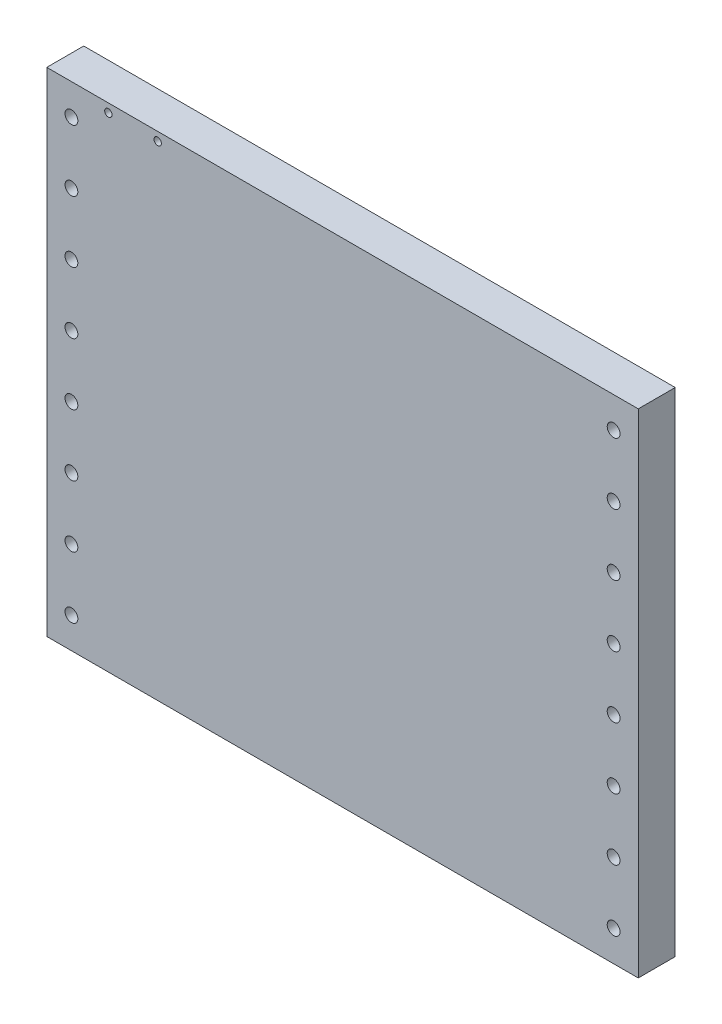
from build123d import *

# Parameters (mm, degrees)
SKETCH1_W           = 240
SKETCH1_H           = 200
BOSS_EXTRUDE1_DEPTH = 7.5
SKETCH4_R           = 2.6
CUT_EXTRUDE3_DEPTH  = 157.923548265
LPATTERN1_COUNT     = 8
LPATTERN1_PITCH     = 25
SKETCH5_R           = 1.5
CUT_EXTRUDE4_DEPTH  = 157.923548265


with BuildPart() as part:
    # Sketch1 → Boss-Extrude1 (new, symmetric)
    with BuildSketch(Plane.XY):
        Rectangle(SKETCH1_W, SKETCH1_H)
    extrude(amount=BOSS_EXTRUDE1_DEPTH, both=True)

    # Sketch4 → Cut-Extrude3 (cut, through all)
    with BuildSketch(Plane.XY.offset(7.5)):
        with Locations((-110, 87.5)):
            Circle(SKETCH4_R)
        with Locations((110, 87.5)):
            Circle(SKETCH4_R)
    cut_extrude3 = extrude(amount=-CUT_EXTRUDE3_DEPTH, mode=Mode.SUBTRACT)

    # LPattern1: Cut-Extrude3 ×8
    with Locations(*[(0, -i * LPATTERN1_PITCH, 0) for i in range(1, LPATTERN1_COUNT)]):
        add(cut_extrude3, mode=Mode.SUBTRACT)

    # Sketch5 → Cut-Extrude4 (cut, through all)
    with BuildSketch(Plane.XY.offset(7.5)):
        with Locations((-95, 96.5)):
            Circle(SKETCH5_R)
        with Locations((-75, 96.5)):
            Circle(SKETCH5_R)
    extrude(amount=-CUT_EXTRUDE4_DEPTH, mode=Mode.SUBTRACT)


solid = part.part
